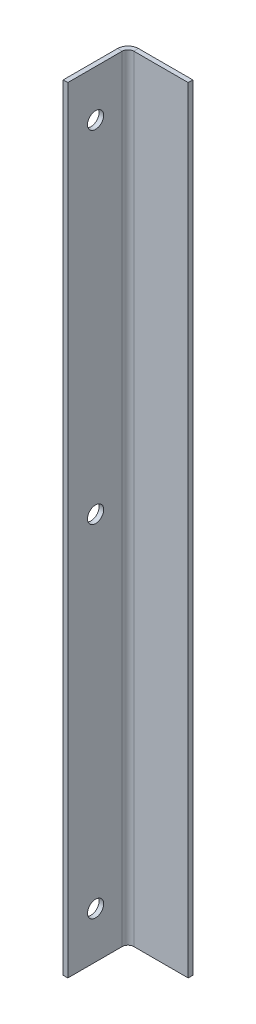
from build123d import *

# Parameters (mm, degrees)
SKETCH1_W                    = 28
SKETCH1_H                    = 335
BASE_FLANGE1_DEPTH           = 2
EDGE_FLANGE1_STRIP_W         = 13
EDGE_FLANGE1_STRIP_H         = 2
EDGE_FLANGE1_STRIP_CUT_DEPTH = 335
EDGE_FLANGE1_DEPTH           = 335
SKETCH9_R                    = 3.5
CUT_EXTRUDE1_DEPTH           = 10
LPATTERN1_COUNT              = 2
LPATTERN1_PITCH              = 147.5


# Sheet-metal steps are written as plain solids
with BuildPart() as part:
    # Sketch1 → Base-Flange1 (new body)
    with BuildSketch(Plane(origin=(0, 0, 0), x_dir=(0, 0, -1), z_dir=(1, 0, 0))):
        Rectangle(SKETCH1_W, SKETCH1_H)
    extrude(amount=-BASE_FLANGE1_DEPTH)

    # Edge-Flange1 strip (across the edge) → Edge-Flange1 strip cut (cut)
    with BuildSketch(Plane(origin=(0, -167.5, -14), x_dir=(0, 0, 1), z_dir=(0, 1, 0))):
        with Locations((-2, -1)):
            Rectangle(EDGE_FLANGE1_STRIP_W, EDGE_FLANGE1_STRIP_H)
    extrude(amount=EDGE_FLANGE1_STRIP_CUT_DEPTH, mode=Mode.SUBTRACT)

    # Edge-Flange1 section (across the edge) → Edge-Flange1 (add)
    with BuildSketch(Plane(origin=(0, -167.5, -14), x_dir=(0, 0, 1), z_dir=(0, 1, 0))):
        with BuildLine():
            Line((0, 2.5), (0, 26))
            Line((0, 26), (2, 26))
            Line((2, 26), (2, 2.5))
            ThreePointArc((2, 2.5), (2.732233047, 0.732233047), (4.5, 0))
            Line((4.5, 0), (4.5, -2))
            ThreePointArc((4.5, -2), (1.318019485, -0.681980515), (0, 2.5))
        make_face()
    extrude(amount=EDGE_FLANGE1_DEPTH)

    # Sketch9 → Cut-Extrude1 (cut)
    with BuildSketch(Plane(origin=(0, 0, 0), x_dir=(0, 0, -1), z_dir=(1, 0, 0))):
        with Locations((-2, 147.5)):
            Circle(SKETCH9_R)
    cut_extrude1 = extrude(amount=-CUT_EXTRUDE1_DEPTH, mode=Mode.SUBTRACT)

    # Mirror1: Cut-Extrude1 across plane
    add(cut_extrude1.mirror(Plane.ZX), mode=Mode.SUBTRACT)

    # LPattern1: Cut-Extrude1 ×2
    with Locations(*[(0, -i * LPATTERN1_PITCH, 0) for i in range(1, LPATTERN1_COUNT)]):
        add(cut_extrude1, mode=Mode.SUBTRACT)


solid = part.part
